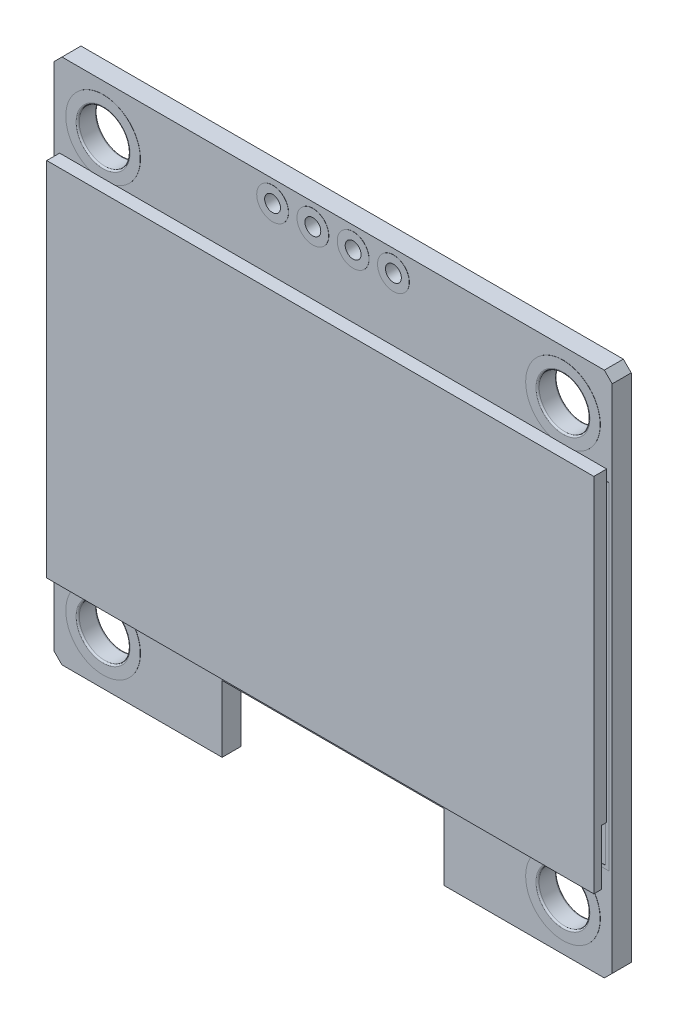
from build123d import *

# Parameters (mm, degrees)
SKETCH1_W               = 35.2
SKETCH1_H               = 33.2
SKETCH1_R               = 1.6
SKETCH1_R_2             = 0.5
BOSS_EXTRUDE1_DEPTH     = 1.2
CUT_EXTRUDE1_DEPTH      = 1.2
SKETCH3_W               = 14
SKETCH3_H               = 4.2
CUT_EXTRUDE2_DEPTH      = 1.2
SKETCH4_R               = 2.35
SKETCH4_R_2             = 1.6
BOSS_EXTRUDE2_DEPTH     = 0.01
BOSS_EXTRUDE3_START     = 0.01
SKETCH5_R               = 2.35
SKETCH5_R_2             = 1.6
BOSS_EXTRUDE3_DEPTH     = 0.01
EXTRUDE_THIN1_DEPTH     = 0.01
CROQUIS2_R              = 1
CROQUIS2_R_2            = 0.5
SALIENTE_EXTRUIR1_DEPTH = 0.01
SALIENTE_EXTRUIR2_START = -1.21
CROQUIS2_2_R            = 1
CROQUIS2_2_R_2          = 0.5
SALIENTE_EXTRUIR2_DEPTH = 0.01
SKETCH10_W              = 34.5
SKETCH10_H              = 22.8
BOSS_EXTRUDE7_DEPTH     = 1.5
SKETCH11_W              = 1
SKETCH11_H              = 3.5
CUT_EXTRUDE3_DEPTH      = 34.5
SKETCH13_W              = 34.2
SKETCH13_H              = 19
BOSS_EXTRUDE8_DEPTH     = 0.2
BOSS_EXTRUDE9_DEPTH     = 0.1
FILLET5_R               = 0.1
SKETCH31_W              = 29.42
SKETCH31_H              = 14.7
CUT_EXTRUDE10_DEPTH     = 0.001
ESCALA1_START           = -17.6
ESCALA1_DEPTH           = 35.2
ESCALA1_START_2         = -34.5
ESCALA1_2_DEPTH         = 69
ESCALA1_START_3         = -34.2
ESCALA1_3_DEPTH         = 68.4
ESCALA1_4_OUTLINE_W     = 29.4
ESCALA1_4_OUTLINE_H     = 0.002
ESCALA1_4_DEPTH         = 4.78
ESCALA1_START_4         = 29.42
ESCALA1_5_OUTLINE_W     = 29.4
ESCALA1_5_OUTLINE_H     = 0.002
ESCALA1_5_DEPTH         = 4.78
ESCALA1_6_OUTLINE_W     = 82.628574934
ESCALA1_6_OUTLINE_H     = 0.02
ESCALA1_START_5         = 1.819910689
ESCALA1_8_OUTLINE_W     = 34.5
ESCALA1_8_OUTLINE_H     = 22.8
ESCALA1_8_DEPTH         = 0.880089311
ESCALA1_START_6         = -0.600089311
ESCALA1_9_OUTLINE_R     = 4.7
ESCALA1_9_OUTLINE_R_2   = 1
ESCALA1_9_DEPTH         = 2.4
ESCALA1_START_7         = -0.420089411
ESCALA1_10_OUTLINE_R    = 4.7
ESCALA1_10_OUTLINE_R_2  = 3.2
ESCALA1_10_DEPTH        = 2.04
ESCALA1_START_8         = 1.799910689
ESCALA1_11_OUTLINE_R    = 2
ESCALA1_11_OUTLINE_R_2  = 1
ESCALA1_11_DEPTH        = 0.02
ESCALA1_START_9         = -0.620089311
ESCALA1_12_OUTLINE_R    = 2
ESCALA1_12_OUTLINE_R_2  = 1
ESCALA1_12_DEPTH        = 0.02


with BuildPart() as part:
    # Sketch1 → Boss-Extrude1 (new body)
    with BuildSketch(Plane.XY):
        Rectangle(SKETCH1_W, SKETCH1_H)
        with Locations((-14.5, 13.5)):
            Circle(SKETCH1_R, mode=Mode.SUBTRACT)
        with Locations((14.5, 13.5)):
            Circle(SKETCH1_R, mode=Mode.SUBTRACT)
        with Locations((14.5, -13.5)):
            Circle(SKETCH1_R, mode=Mode.SUBTRACT)
        with Locations((-14.5, -13.5)):
            Circle(SKETCH1_R, mode=Mode.SUBTRACT)
        with Locations((-3.81, 15.25)):
            Circle(SKETCH1_R_2, mode=Mode.SUBTRACT)
        with Locations((-1.27, 15.25)):
            Circle(SKETCH1_R_2, mode=Mode.SUBTRACT)
        with Locations((1.27, 15.25)):
            Circle(SKETCH1_R_2, mode=Mode.SUBTRACT)
        with Locations((3.81, 15.25)):
            Circle(SKETCH1_R_2, mode=Mode.SUBTRACT)
    extrude(amount=BOSS_EXTRUDE1_DEPTH)

    # Sketch2 → Cut-Extrude1 (cut)
    with BuildSketch(Plane.XY.offset(1.2)):
        Polygon((-17.1, 16.6), (-17.6, 16.6), (-17.6, 16.1), align=None)
        Polygon((17.6, 16.6), (17.1, 16.6), (17.6, 16.1), align=None)
        Polygon((-17.6, -16.6), (-17.6, -16.1), (-17.1, -16.6), align=None)
        Polygon((17.6, -16.6), (17.6, -16.1), (17.1, -16.6), align=None)
    extrude(amount=-CUT_EXTRUDE1_DEPTH, mode=Mode.SUBTRACT)

    # Sketch3 → Cut-Extrude2 (cut)
    with BuildSketch(Plane.XY.offset(1.2)):
        with Locations((0, -14.5)):
            Rectangle(SKETCH3_W, SKETCH3_H)
    extrude(amount=-CUT_EXTRUDE2_DEPTH, mode=Mode.SUBTRACT)

    # Sketch4 → Boss-Extrude2 (add)
    # profile 1 of 4: a face of its own
    with BuildSketch(Plane.XY.offset(1.2)):
        with Locations((-14.5, 13.5)):
            Circle(SKETCH4_R)
        with Locations((-14.5, 13.5)):
            Circle(SKETCH4_R_2, mode=Mode.SUBTRACT)
    # profile 2 of 4: a face of its own
    with BuildSketch(Plane.XY.offset(1.2)):
        with Locations((14.5, 13.5)):
            Circle(SKETCH4_R)
        with Locations((14.5, 13.5)):
            Circle(SKETCH4_R_2, mode=Mode.SUBTRACT)
    # profile 3 of 4: a face of its own
    with BuildSketch(Plane.XY.offset(1.2)):
        with Locations((-14.5, -13.5)):
            Circle(SKETCH4_R)
        with Locations((-14.5, -13.5)):
            Circle(SKETCH4_R_2, mode=Mode.SUBTRACT)
    # profile 4 of 4: a face of its own
    with BuildSketch(Plane.XY.offset(1.2)):
        with Locations((14.5, -13.5)):
            Circle(SKETCH4_R)
        with Locations((14.5, -13.5)):
            Circle(SKETCH4_R_2, mode=Mode.SUBTRACT)
    extrude(amount=BOSS_EXTRUDE2_DEPTH)

    # Sketch5 → Boss-Extrude3 (add)
    # profile 1 of 4: a face of its own
    with BuildSketch(Plane(origin=(0, 0, 0), x_dir=(-1, 0, 0), z_dir=(0, 0, -1)).offset(BOSS_EXTRUDE3_START)):
        with Locations((14.5, 13.5)):
            Circle(SKETCH5_R)
        with Locations((14.5, 13.5)):
            Circle(SKETCH5_R_2, mode=Mode.SUBTRACT)
    # profile 2 of 4: a face of its own
    with BuildSketch(Plane(origin=(0, 0, 0), x_dir=(-1, 0, 0), z_dir=(0, 0, -1)).offset(BOSS_EXTRUDE3_START)):
        with Locations((-14.5, 13.5)):
            Circle(SKETCH5_R)
        with Locations((-14.5, 13.5)):
            Circle(SKETCH5_R_2, mode=Mode.SUBTRACT)
    # profile 3 of 4: a face of its own
    with BuildSketch(Plane(origin=(0, 0, 0), x_dir=(-1, 0, 0), z_dir=(0, 0, -1)).offset(BOSS_EXTRUDE3_START)):
        with Locations((-14.5, -13.5)):
            Circle(SKETCH5_R)
        with Locations((-14.5, -13.5)):
            Circle(SKETCH5_R_2, mode=Mode.SUBTRACT)
    # profile 4 of 4: a face of its own
    with BuildSketch(Plane(origin=(0, 0, 0), x_dir=(-1, 0, 0), z_dir=(0, 0, -1)).offset(BOSS_EXTRUDE3_START)):
        with Locations((14.5, -13.5)):
            Circle(SKETCH5_R)
        with Locations((14.5, -13.5)):
            Circle(SKETCH5_R_2, mode=Mode.SUBTRACT)
    extrude(amount=-BOSS_EXTRUDE3_DEPTH)

    # Sketch6 → Extrude-Thin1 (add)
    with BuildSketch(Plane.XY.offset(1.2)):
        Polygon((-8, 10.6), (-17.4, 10.6), (-17.4, -10.6), (17.4, -10.6), (17.4, 10.6), (8, 10.6), (8, 10.4), (17.2, 10.4), (17.2, -10.4), (-17.2, -10.4), (-17.2, 10.4), (-8, 10.4), align=None)
    extrude(amount=EXTRUDE_THIN1_DEPTH)

    # Croquis2 → Saliente-Extruir1 (add)
    # profile 1 of 4: a face of its own
    with BuildSketch(Plane.XY.offset(1.2)):
        with Locations(Location((-3.81, 15.25, 0), (0, 0, 180))):
            Circle(CROQUIS2_R)
        with Locations((-3.81, 15.25)):
            Circle(CROQUIS2_R_2, mode=Mode.SUBTRACT)
    # profile 2 of 4: a face of its own
    with BuildSketch(Plane.XY.offset(1.2)):
        with Locations(Location((-1.27, 15.25, 0), (0, 0, 180))):
            Circle(CROQUIS2_R)
        with Locations((-1.27, 15.25)):
            Circle(CROQUIS2_R_2, mode=Mode.SUBTRACT)
    # profile 3 of 4: a face of its own
    with BuildSketch(Plane.XY.offset(1.2)):
        with Locations(Location((1.27, 15.25, 0), (0, 0, 180))):
            Circle(CROQUIS2_R)
        with Locations((1.27, 15.25)):
            Circle(CROQUIS2_R_2, mode=Mode.SUBTRACT)
    # profile 4 of 4: a face of its own
    with BuildSketch(Plane.XY.offset(1.2)):
        with Locations(Location((3.81, 15.25, 0), (0, 0, 180))):
            Circle(CROQUIS2_R)
        with Locations((3.81, 15.25)):
            Circle(CROQUIS2_R_2, mode=Mode.SUBTRACT)
    extrude(amount=SALIENTE_EXTRUIR1_DEPTH)

    # Croquis2<2> → Saliente-Extruir2 (add)
    # profile 1 of 4: a face of its own
    with BuildSketch(Plane.XY.offset(1.2).offset(SALIENTE_EXTRUIR2_START)):
        with Locations(Location((-3.81, 15.25, 0), (0, 0, 180))):
            Circle(CROQUIS2_2_R)
        with Locations((-3.81, 15.25)):
            Circle(CROQUIS2_2_R_2, mode=Mode.SUBTRACT)
    # profile 2 of 4: a face of its own
    with BuildSketch(Plane.XY.offset(1.2).offset(SALIENTE_EXTRUIR2_START)):
        with Locations(Location((-1.27, 15.25, 0), (0, 0, 180))):
            Circle(CROQUIS2_2_R)
        with Locations((-1.27, 15.25)):
            Circle(CROQUIS2_2_R_2, mode=Mode.SUBTRACT)
    # profile 3 of 4: a face of its own
    with BuildSketch(Plane.XY.offset(1.2).offset(SALIENTE_EXTRUIR2_START)):
        with Locations(Location((1.27, 15.25, 0), (0, 0, 180))):
            Circle(CROQUIS2_2_R)
        with Locations((1.27, 15.25)):
            Circle(CROQUIS2_2_R_2, mode=Mode.SUBTRACT)
    # profile 4 of 4: a face of its own
    with BuildSketch(Plane.XY.offset(1.2).offset(SALIENTE_EXTRUIR2_START)):
        with Locations(Location((3.81, 15.25, 0), (0, 0, 180))):
            Circle(CROQUIS2_2_R)
        with Locations((3.81, 15.25)):
            Circle(CROQUIS2_2_R_2, mode=Mode.SUBTRACT)
    extrude(amount=SALIENTE_EXTRUIR2_DEPTH)

    # Fillet5
    # the kernel refuses this fillet: 0.1 mm, written as the material it takes off along each edge
    with BuildSketch(Plane(origin=(-14.5, 13.5, 1.21), x_dir=(1, 0, 0), z_dir=(0, -1, 0))) as fillet5_piece_1:
        with BuildLine():
            CenterArc((1.6 + FILLET5_R, -FILLET5_R), FILLET5_R, 90, 90)
            Line((1.6, -FILLET5_R), (1.6, 0))
            Line((1.6, 0), (1.6 + FILLET5_R, 0))
        make_face()
    revolve(axis=Axis((-14.5, 13.5, 1.21), (0, 0, 1)), mode=Mode.SUBTRACT)
    with BuildSketch(Plane(origin=(14.5, 13.5, 1.21), x_dir=(1, 0, 0), z_dir=(0, -1, 0))) as fillet5_piece_2:
        with BuildLine():
            CenterArc((1.6 + FILLET5_R, -FILLET5_R), FILLET5_R, 90, 90)
            Line((1.6, -FILLET5_R), (1.6, 0))
            Line((1.6, 0), (1.6 + FILLET5_R, 0))
        make_face()
    revolve(axis=Axis((14.5, 13.5, 1.21), (0, 0, 1)), mode=Mode.SUBTRACT)
    with BuildSketch(Plane(origin=(-14.5, -13.5, 1.21), x_dir=(1, 0, 0), z_dir=(0, -1, 0))) as fillet5_piece_3:
        with BuildLine():
            CenterArc((1.6 + FILLET5_R, -FILLET5_R), FILLET5_R, 90, 90)
            Line((1.6, -FILLET5_R), (1.6, 0))
            Line((1.6, 0), (1.6 + FILLET5_R, 0))
        make_face()
    revolve(axis=Axis((-14.5, -13.5, 1.21), (0, 0, 1)), mode=Mode.SUBTRACT)
    with BuildSketch(Plane(origin=(14.5, -13.5, 1.21), x_dir=(1, 0, 0), z_dir=(0, -1, 0))) as fillet5_piece_4:
        with BuildLine():
            CenterArc((1.6 + FILLET5_R, -FILLET5_R), FILLET5_R, 90, 90)
            Line((1.6, -FILLET5_R), (1.6, 0))
            Line((1.6, 0), (1.6 + FILLET5_R, 0))
        make_face()
    revolve(axis=Axis((14.5, -13.5, 1.21), (0, 0, 1)), mode=Mode.SUBTRACT)
    with BuildSketch(Plane(origin=(-14.5, 13.5, -0.01), x_dir=(-1, 0, 0), z_dir=(0, -1, 0))) as fillet5_piece_5:
        with BuildLine():
            CenterArc((1.6 + FILLET5_R, -FILLET5_R), FILLET5_R, 90, 90)
            Line((1.6, -FILLET5_R), (1.6, 0))
            Line((1.6, 0), (1.6 + FILLET5_R, 0))
        make_face()
    revolve(axis=Axis((-14.5, 13.5, -0.01), (0, 0, -1)), mode=Mode.SUBTRACT)
    with BuildSketch(Plane(origin=(14.5, 13.5, -0.01), x_dir=(-1, 0, 0), z_dir=(0, -1, 0))) as fillet5_piece_6:
        with BuildLine():
            CenterArc((1.6 + FILLET5_R, -FILLET5_R), FILLET5_R, 90, 90)
            Line((1.6, -FILLET5_R), (1.6, 0))
            Line((1.6, 0), (1.6 + FILLET5_R, 0))
        make_face()
    revolve(axis=Axis((14.5, 13.5, -0.01), (0, 0, -1)), mode=Mode.SUBTRACT)
    with BuildSketch(Plane(origin=(14.5, -13.5, -0.01), x_dir=(-1, 0, 0), z_dir=(0, -1, 0))) as fillet5_piece_7:
        with BuildLine():
            CenterArc((1.6 + FILLET5_R, -FILLET5_R), FILLET5_R, 90, 90)
            Line((1.6, -FILLET5_R), (1.6, 0))
            Line((1.6, 0), (1.6 + FILLET5_R, 0))
        make_face()
    revolve(axis=Axis((14.5, -13.5, -0.01), (0, 0, -1)), mode=Mode.SUBTRACT)
    with BuildSketch(Plane(origin=(-14.5, -13.5, -0.01), x_dir=(-1, 0, 0), z_dir=(0, -1, 0))) as fillet5_piece_8:
        with BuildLine():
            CenterArc((1.6 + FILLET5_R, -FILLET5_R), FILLET5_R, 90, 90)
            Line((1.6, -FILLET5_R), (1.6, 0))
            Line((1.6, 0), (1.6 + FILLET5_R, 0))
        make_face()
    revolve(axis=Axis((-14.5, -13.5, -0.01), (0, 0, -1)), mode=Mode.SUBTRACT)

    # Escala1: read off the stored shape, not the designer's step
    # Escala1 outline → Escala1 (cut)
    with BuildSketch(Plane.YZ.offset(ESCALA1_START)):
        Polygon((-16.800162866, 2.421498371), (-23.800162866, 2.421498371), (-23.800162866, 3.421498371), (-12.4, 3.421498371), (-12.4, 5), (-25, 5), (-25, -2), (-10.6, -2), (-10.6, 0), (-10.4, 0), (-10.4, -2), (23, -2), (23, 5), (-10.4, 5), (-10.4, 3.421498371), (21.799837134, 3.421498371), (21.799837134, 0.421498371), (-16.800162866, 0.421498371), align=None)
    extrude(amount=ESCALA1_DEPTH, mode=Mode.SUBTRACT)

    # Escala1 2 outline → Escala1 2 (add)
    with BuildSketch(Plane.YZ.offset(ESCALA1_START_2)):
        Polygon((-23.800162866, 3.421498371), (-23.800162866, 2.421498371), (-16.800162866, 2.421498371), (-16.800162866, 0.421498371), (21.799837134, 0.421498371), (21.799837134, 3.421498371), align=None)
    extrude(amount=ESCALA1_2_DEPTH)


with BuildPart() as body_2:
    # Sketch10 → Boss-Extrude7 (new body)
    with BuildSketch(Plane.XY.offset(1.2)):
        with Locations((0, 0.1)):
            Rectangle(SKETCH10_W, SKETCH10_H)
    extrude(amount=BOSS_EXTRUDE7_DEPTH)

    # Sketch11 → Cut-Extrude3 (cut)
    with BuildSketch(Plane(origin=(17.25, 0, 0), x_dir=(0, 0, -1), z_dir=(1, 0, 0))):
        with Locations((-1.7, -9.55)):
            Rectangle(SKETCH11_W, SKETCH11_H)
    extrude(amount=-CUT_EXTRUDE3_DEPTH, mode=Mode.SUBTRACT)

    # Escala1 6 outline → Escala1 6 (revolve, cut)
    with BuildSketch(Plane(origin=(29, 26.249356151, 0), x_dir=(1, 0, 0), z_dir=(0, -1, 0))):
        with Locations((46.014287467, 1.809910689)):
            Rectangle(ESCALA1_6_OUTLINE_W, ESCALA1_6_OUTLINE_H)
    revolve(axis=Axis((29, 26.249356151, 0), (0, 0, 1)), mode=Mode.SUBTRACT)

    # Escala1 7 outline → Escala1 7 (revolve)
    with BuildSketch(Plane(origin=(29, 26.249356151, 0), x_dir=(1, 0, 0), z_dir=(0, -1, 0))):
        with BuildLine():
            Line((4.7, 1.819910689), (3.4, 1.819910689))
            ThreePointArc((3.4, 1.819910689), (3.258578644, 1.761332045), (3.2, 1.619910689))
            Line((3.2, 1.619910689), (3.2, -0.420089311))
            ThreePointArc((3.2, -0.420089311), (3.258578644, -0.561510667), (3.4, -0.620089311))
            Line((3.4, -0.620089311), (4.7, -0.620089311))
            Line((4.7, -0.620089311), (4.7, 1.819910689))
        make_face()
    revolve(axis=Axis((29, 26.249356151, 0), (0, 0, 1)))

    # Escala1 8 outline → Escala1 8 (cut)
    with BuildSketch(Plane.XY.offset(ESCALA1_START_5)):
        with Locations((0, 0.1)):
            Rectangle(ESCALA1_8_OUTLINE_W, ESCALA1_8_OUTLINE_H)
    extrude(amount=ESCALA1_8_DEPTH, mode=Mode.SUBTRACT)

    # Escala1 9 outline → Escala1 9 (add)
    with BuildSketch(Plane.XY.offset(ESCALA1_START_6)):
        Polygon((-34.2, -33.950643849), (-14, -33.950643849), (-14, -25.550643849), (14, -25.550643849), (14, -33.950643849), (34.2, -33.950643849), (35.2, -32.950643849), (35.2, 31.449356151), (34.2, 32.449356151), (-34.2, 32.449356151), (-35.2, 31.449356151), (-35.2, -32.950643849), align=None)
        with Locations((-29, -27.750643849)):
            Circle(ESCALA1_9_OUTLINE_R, mode=Mode.SUBTRACT)
        with Locations((29, -27.750643849)):
            Circle(ESCALA1_9_OUTLINE_R, mode=Mode.SUBTRACT)
        with Locations((-29, 26.249356151)):
            Circle(ESCALA1_9_OUTLINE_R, mode=Mode.SUBTRACT)
        with Locations((29, 26.249356151)):
            Circle(ESCALA1_9_OUTLINE_R, mode=Mode.SUBTRACT)
        with Locations((-7.62, 29.749356151)):
            Circle(ESCALA1_9_OUTLINE_R_2, mode=Mode.SUBTRACT)
        with Locations((-2.54, 29.749356151)):
            Circle(ESCALA1_9_OUTLINE_R_2, mode=Mode.SUBTRACT)
        with Locations((2.54, 29.749356151)):
            Circle(ESCALA1_9_OUTLINE_R_2, mode=Mode.SUBTRACT)
        with Locations((7.62, 29.749356151)):
            Circle(ESCALA1_9_OUTLINE_R_2, mode=Mode.SUBTRACT)
    extrude(amount=ESCALA1_9_DEPTH)

    # Escala1 10 outline → Escala1 10 (add)
    # profile 1 of 3: a face of its own
    with BuildSketch(Plane.XY.offset(ESCALA1_START_7)):
        with Locations((-29, 26.249356151)):
            Circle(ESCALA1_10_OUTLINE_R)
        with Locations((-29, 26.249356151)):
            Circle(ESCALA1_10_OUTLINE_R_2, mode=Mode.SUBTRACT)
    # profile 2 of 3: a face of its own
    with BuildSketch(Plane.XY.offset(ESCALA1_START_7)):
        with Locations((-29, -27.750643849)):
            Circle(ESCALA1_10_OUTLINE_R)
        with Locations((-29, -27.750643849)):
            Circle(ESCALA1_10_OUTLINE_R_2, mode=Mode.SUBTRACT)
    # profile 3 of 3: a face of its own
    with BuildSketch(Plane.XY.offset(ESCALA1_START_7)):
        with Locations((29, -27.750643849)):
            Circle(ESCALA1_10_OUTLINE_R)
        with Locations((29, -27.750643849)):
            Circle(ESCALA1_10_OUTLINE_R_2, mode=Mode.SUBTRACT)
    extrude(amount=ESCALA1_10_DEPTH)

    # Escala1 11 outline → Escala1 11 (add)
    # profile 1 of 5: a face of its own
    with BuildSketch(Plane.XY.offset(ESCALA1_START_8)):
        Polygon((34.8, 20.449356151), (16, 20.449356151), (16, 20.049356151), (34.4, 20.049356151), (34.4, -21.550643849), (-34.4, -21.550643849), (-34.4, 20.049356151), (-16, 20.049356151), (-16, 20.449356151), (-34.8, 20.449356151), (-34.8, -21.950643849), (34.8, -21.950643849), align=None)
    # profile 2 of 5: a face of its own
    with BuildSketch(Plane.XY.offset(ESCALA1_START_8)):
        with Locations((-2.54, 29.749356151)):
            Circle(ESCALA1_11_OUTLINE_R)
        with Locations((-2.54, 29.749356151)):
            Circle(ESCALA1_11_OUTLINE_R_2, mode=Mode.SUBTRACT)
    # profile 3 of 5: a face of its own
    with BuildSketch(Plane.XY.offset(ESCALA1_START_8)):
        with Locations((-7.62, 29.749356151)):
            Circle(ESCALA1_11_OUTLINE_R)
        with Locations((-7.62, 29.749356151)):
            Circle(ESCALA1_11_OUTLINE_R_2, mode=Mode.SUBTRACT)
    # profile 4 of 5: a face of its own
    with BuildSketch(Plane.XY.offset(ESCALA1_START_8)):
        with Locations((2.54, 29.749356151)):
            Circle(ESCALA1_11_OUTLINE_R)
        with Locations((2.54, 29.749356151)):
            Circle(ESCALA1_11_OUTLINE_R_2, mode=Mode.SUBTRACT)
    # profile 5 of 5: a face of its own
    with BuildSketch(Plane.XY.offset(ESCALA1_START_8)):
        with Locations((7.62, 29.749356151)):
            Circle(ESCALA1_11_OUTLINE_R)
        with Locations((7.62, 29.749356151)):
            Circle(ESCALA1_11_OUTLINE_R_2, mode=Mode.SUBTRACT)
    extrude(amount=ESCALA1_11_DEPTH)

    # Escala1 12 outline → Escala1 12 (add)
    # profile 1 of 4: a face of its own
    with BuildSketch(Plane.XY.offset(ESCALA1_START_9)):
        with Locations((-2.54, 29.749356151)):
            Circle(ESCALA1_12_OUTLINE_R)
        with Locations((-2.54, 29.749356151)):
            Circle(ESCALA1_12_OUTLINE_R_2, mode=Mode.SUBTRACT)
    # profile 2 of 4: a face of its own
    with BuildSketch(Plane.XY.offset(ESCALA1_START_9)):
        with Locations((-7.62, 29.749356151)):
            Circle(ESCALA1_12_OUTLINE_R)
        with Locations((-7.62, 29.749356151)):
            Circle(ESCALA1_12_OUTLINE_R_2, mode=Mode.SUBTRACT)
    # profile 3 of 4: a face of its own
    with BuildSketch(Plane.XY.offset(ESCALA1_START_9)):
        with Locations((2.54, 29.749356151)):
            Circle(ESCALA1_12_OUTLINE_R)
        with Locations((2.54, 29.749356151)):
            Circle(ESCALA1_12_OUTLINE_R_2, mode=Mode.SUBTRACT)
    # profile 4 of 4: a face of its own
    with BuildSketch(Plane.XY.offset(ESCALA1_START_9)):
        with Locations((7.62, 29.749356151)):
            Circle(ESCALA1_12_OUTLINE_R)
        with Locations((7.62, 29.749356151)):
            Circle(ESCALA1_12_OUTLINE_R_2, mode=Mode.SUBTRACT)
    extrude(amount=ESCALA1_12_DEPTH)

    # Escala1 13 outline → Escala1 13 (revolve)
    with BuildSketch(Plane(origin=(-29, 26.249356151, 0), x_dir=(1, 0, 0), z_dir=(0, -1, 0))):
        with BuildLine():
            Line((4.7, 1.619910589), (4.7, 1.819910689))
            Line((4.7, 1.819910689), (3.4, 1.819910689))
            ThreePointArc((3.4, 1.819910689), (3.258578644, 1.761332045), (3.2, 1.619910689))
            Line((3.2, 1.619910689), (4.7, 1.619910589))
        make_face()
        with BuildLine():
            Line((4.7, -0.620089311), (4.7, -0.420089411))
            Line((4.7, -0.420089411), (3.2, -0.420089311))
            ThreePointArc((3.2, -0.420089311), (3.258578644, -0.561510667), (3.4, -0.620089311))
            Line((3.4, -0.620089311), (4.7, -0.620089311))
        make_face()
    revolve(axis=Axis((-29, 26.249356151, 0), (0, 0, 1)))

    # Escala1 14 outline → Escala1 14 (revolve)
    with BuildSketch(Plane(origin=(-29, -27.750643849, 0), x_dir=(1, 0, 0), z_dir=(0, -1, 0))):
        with BuildLine():
            Line((4.7, 1.819910689), (3.4, 1.819910689))
            ThreePointArc((3.4, 1.819910689), (3.258578644, 1.761332045), (3.2, 1.619910689))
            Line((3.2, 1.619910689), (4.7, 1.619910589))
            Line((4.7, 1.619910589), (4.7, 1.819910689))
        make_face()
        with BuildLine():
            Line((4.7, -0.620089311), (4.7, -0.420089411))
            Line((4.7, -0.420089411), (3.2, -0.420089311))
            ThreePointArc((3.2, -0.420089311), (3.258578644, -0.561510667), (3.4, -0.620089311))
            Line((3.4, -0.620089311), (4.7, -0.620089311))
        make_face()
    revolve(axis=Axis((-29, -27.750643849, 0), (0, 0, 1)))

    # Escala1 15 outline → Escala1 15 (revolve)
    with BuildSketch(Plane(origin=(29, -27.750643849, 0), x_dir=(1, 0, 0), z_dir=(0, -1, 0))):
        with BuildLine():
            Line((4.7, 1.819910689), (3.4, 1.819910689))
            ThreePointArc((3.4, 1.819910689), (3.258578644, 1.761332045), (3.2, 1.619910689))
            Line((3.2, 1.619910689), (4.7, 1.619910589))
            Line((4.7, 1.619910589), (4.7, 1.819910689))
        make_face()
        with BuildLine():
            Line((4.7, -0.620089311), (4.7, -0.420089411))
            Line((4.7, -0.420089411), (3.2, -0.420089311))
            ThreePointArc((3.2, -0.420089311), (3.258578644, -0.561510667), (3.4, -0.620089311))
            Line((3.4, -0.620089311), (4.7, -0.620089311))
        make_face()
    revolve(axis=Axis((29, -27.750643849, 0), (0, 0, 1)))


with BuildPart() as body_3:
    # Sketch13 → Boss-Extrude8 (new body)
    with BuildSketch(Plane.XY.offset(2.7)):
        with Locations((0, 1.85)):
            Rectangle(SKETCH13_W, SKETCH13_H)
    extrude(amount=BOSS_EXTRUDE8_DEPTH)

    # Sketch31 → Cut-Extrude10 (cut)
    with BuildSketch(Plane.XY.offset(2.9)):
        with Locations((0, 1.9)):
            Rectangle(SKETCH31_W, SKETCH31_H)
    extrude(amount=-CUT_EXTRUDE10_DEPTH, mode=Mode.SUBTRACT)

    # Escala1 3 outline → Escala1 3 (add)
    with BuildSketch(Plane.YZ.offset(ESCALA1_START_3)):
        Polygon((-17.149833057, 3.000332216), (-17.149833057, 2.600332216), (20.850166943, 2.600332216), (20.850166943, 3.000332216), (16.650166943, 3.000332216), (16.650166943, 2.998332216), (-12.749833057, 2.998332216), (-12.749833057, 3.000332216), align=None)
    extrude(amount=ESCALA1_3_DEPTH)

    # Escala1 4 outline → Escala1 4 (add)
    with BuildSketch(Plane.YZ.offset(ESCALA1_START_3)):
        with Locations((1.950166943, 2.999332216)):
            Rectangle(ESCALA1_4_OUTLINE_W, ESCALA1_4_OUTLINE_H)
    extrude(amount=ESCALA1_4_DEPTH)

    # Escala1 5 outline → Escala1 5 (add)
    with BuildSketch(Plane.YZ.offset(ESCALA1_START_4)):
        with Locations((1.950166943, 2.999332216)):
            Rectangle(ESCALA1_5_OUTLINE_W, ESCALA1_5_OUTLINE_H)
    extrude(amount=ESCALA1_5_DEPTH)


with BuildPart() as body_4:
    # Sketch14 → Boss-Extrude9 (new body)
    with BuildSketch(Plane(origin=(0, 0, 2.2), x_dir=(-1, 0, 0), z_dir=(0, 0, -1))):
        Polygon((-13, -7.8), (13, -7.8), (4, -10.3), (-4, -10.3), align=None)
    extrude(amount=BOSS_EXTRUDE9_DEPTH)

    # Escala1 16: loft between two sections, ruled curve by curve
    escala1_16_from = [
        Edge.make_line((8, -11.770588235, 2.25), (8, -11.770588235, 2.05)),
        Edge.make_line((-8, -11.770588235, 2.25), (-8, -11.770588235, 2.05)),
        Edge.make_line((8, -11.770588235, 2.05), (-8, -11.770588235, 2.05)),
        Edge.make_line((8, -11.770588235, 2.25), (-8, -11.770588235, 2.25)),
    ]
    escala1_16_to = [
        Edge.make_line((26, -6.770588235, 2.25), (26, -6.770588235, 2.05)),
        Edge.make_line((-26, -6.770588235, 2.25), (-26, -6.770588235, 2.05)),
        Edge.make_line((26, -6.770588235, 2.05), (-26, -6.770588235, 2.05)),
        Edge.make_line((26, -6.770588235, 2.25), (-26, -6.770588235, 2.25)),
    ]
    escala1_16 = Solid(Shell([*[Face.make_surface_from_curves(escala1_16_from[k], escala1_16_to[k]) for k in range(4)], Face(Wire(escala1_16_from)), Face(Wire(escala1_16_to))]))
    add(escala1_16)


solid = Compound([part.part, body_2.part, body_3.part, body_4.part])
